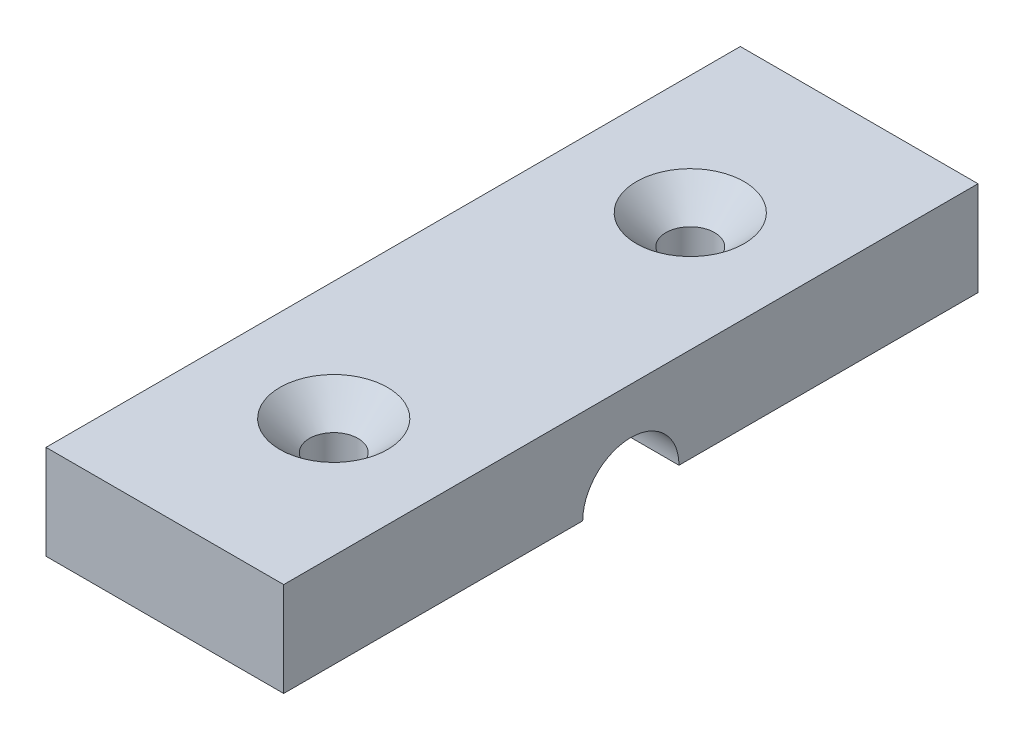
from build123d import *

# Parameters (mm, degrees)
SKETCH1_W           = 20
SKETCH1_H           = 58.42
SKETCH1_R           = 2.05
BOSS_EXTRUDE1_DEPTH = 7.9375
SKETCH2_R           = 4.05
CUT_EXTRUDE1_DEPTH  = 15
CHAMFER1_SIZE       = 2.48


with BuildPart() as part:
    # Sketch1 → Boss-Extrude1 (new body)
    with BuildSketch(Plane(origin=(0, -110.068674648, 0), x_dir=(1, 0, 0), z_dir=(0, 1, 0))):
        with Locations((78.333864278, -62.627324848)):
            Rectangle(SKETCH1_W, SKETCH1_H)
        with Locations((78.333864278, -77.627324848)):
            Circle(SKETCH1_R, mode=Mode.SUBTRACT)
        with Locations((78.333864278, -47.627324848)):
            Circle(SKETCH1_R, mode=Mode.SUBTRACT)
    extrude(amount=BOSS_EXTRUDE1_DEPTH)

    # Sketch2 → Cut-Extrude1 (cut)
    with BuildSketch(Plane(origin=(88.333864278, -1.5875, 4.936331956), x_dir=(0, 0, -1), z_dir=(1, 0, 0))):
        with Locations((-57.690992892, -108.481174648)):
            Circle(SKETCH2_R)
    extrude(amount=-CUT_EXTRUDE1_DEPTH, mode=Mode.SUBTRACT)

    # Chamfer1
    chamfer1_edges = [part.edges().sort_by_distance(p)[0] for p in [
        (76.283864278, -102.131174648, 47.627324848),
        (76.283864278, -102.131174648, 77.627324848),
    ]]
    chamfer(chamfer1_edges, length=CHAMFER1_SIZE)


solid = part.part
